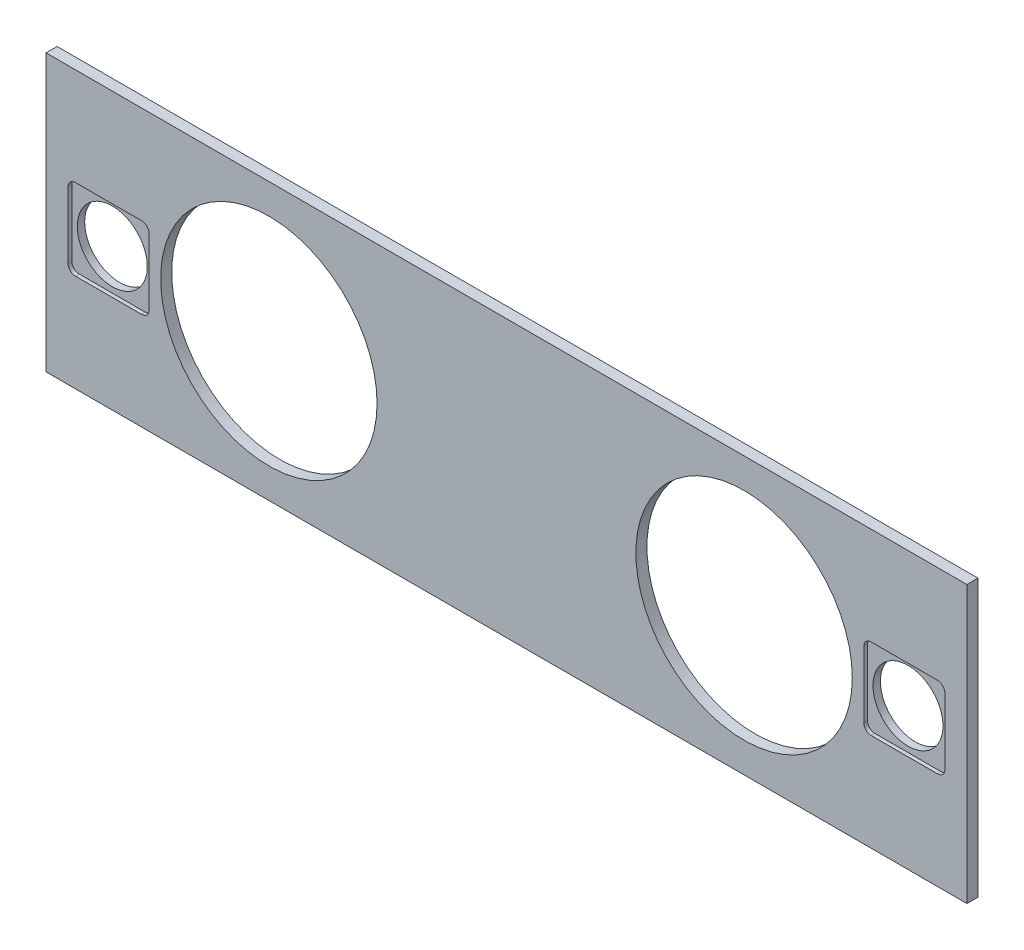
from build123d import *

# Parameters (mm, degrees)
SKETCH1_W           = 1000
SKETCH1_H           = 300
SKETCH1_R           = 38
SKETCH1_R_2         = 117.5
BOSS_EXTRUDE1_DEPTH = 12
CUT_EXTRUDE1_DEPTH  = 4


with BuildPart() as part:
    # Sketch1 → Boss-Extrude1 (new body)
    with BuildSketch(Plane.XY):
        with Locations((500, 150)):
            Rectangle(SKETCH1_W, SKETCH1_H)
        with Locations((68, 150)):
            Circle(SKETCH1_R, mode=Mode.SUBTRACT)
        with Locations((242, 150)):
            Circle(SKETCH1_R_2, mode=Mode.SUBTRACT)
        with Locations((758, 150)):
            Circle(SKETCH1_R_2, mode=Mode.SUBTRACT)
        with Locations((932, 150)):
            Circle(SKETCH1_R, mode=Mode.SUBTRACT)
    extrude(amount=BOSS_EXTRUDE1_DEPTH)

    # Sketch4 → Cut-Extrude1 (cut)
    with BuildSketch(Plane.XY.offset(12)):
        with BuildLine():
            Line((32, 194), (104, 194))
            ThreePointArc((104, 194), (109.656854249, 191.656854249), (112, 186))
            Line((112, 186), (112, 114))
            ThreePointArc((112, 114), (109.656854249, 108.343145751), (104, 106))
            Line((104, 106), (32, 106))
            ThreePointArc((32, 106), (26.343145751, 108.343145751), (24, 114))
            Line((24, 114), (24, 186))
            ThreePointArc((24, 186), (26.343145751, 191.656854249), (32, 194))
        make_face()
        with BuildLine():
            Line((968, 106), (896, 106))
            ThreePointArc((896, 106), (890.343145751, 108.343145751), (888, 114))
            Line((888, 114), (888, 186))
            ThreePointArc((888, 186), (890.343145751, 191.656854249), (896, 194))
            Line((896, 194), (968, 194))
            ThreePointArc((968, 194), (973.656854249, 191.656854249), (976, 186))
            Line((976, 186), (976, 114))
            ThreePointArc((976, 114), (973.656854249, 108.343145751), (968, 106))
        make_face()
    extrude(amount=-CUT_EXTRUDE1_DEPTH, mode=Mode.SUBTRACT)


solid = part.part
